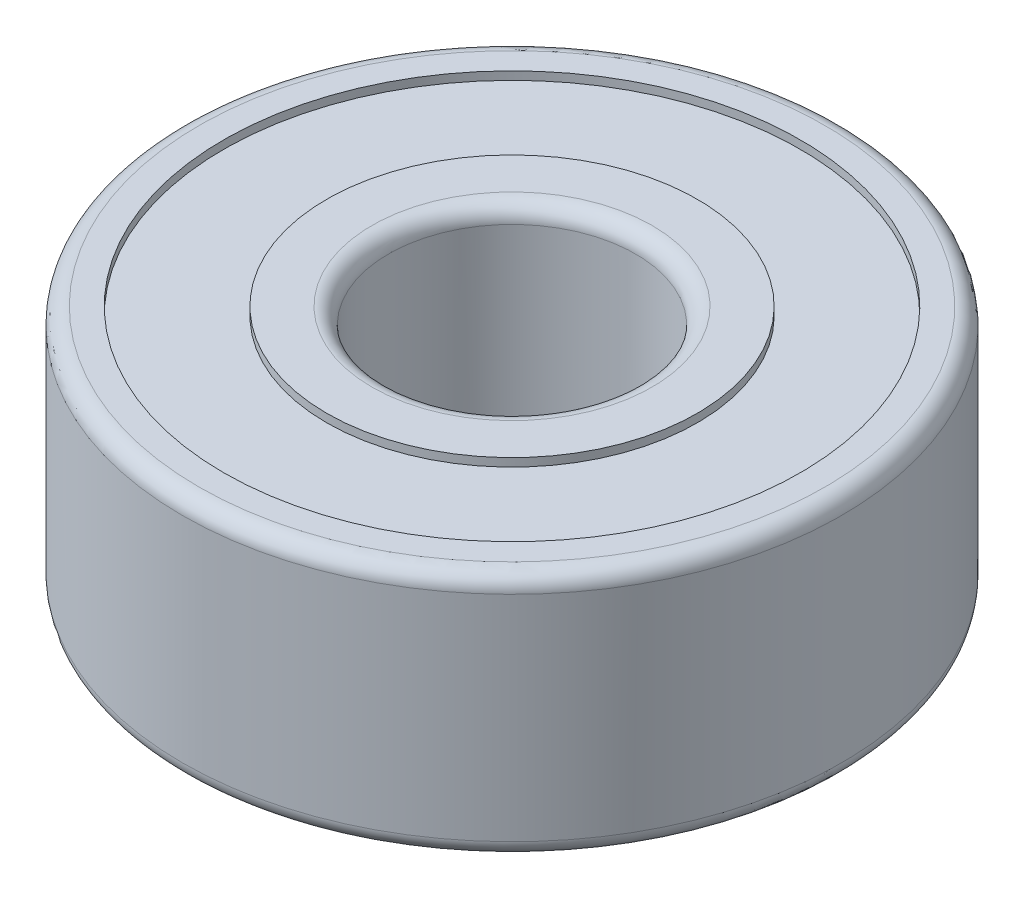
from build123d import *

# Parameters (mm, degrees)
FILLET1_R            = 0.2
FILLET1_OF_MIRROR1_R = 0.2


with BuildPart() as part:
    # Sketch1 → Revolve1 (revolve)
    with BuildSketch(Plane(origin=(0, 0, 0), x_dir=(0, 0, -1), z_dir=(1, 0, 0))):
        Polygon((-4, 1.5), (-3.5, 1.5), (-3.5, 1.4), (-2.25, 1.4), (-2.25, 1.5), (-1.5, 1.5), (-1.5, 0), (-4, 0), align=None)
    revolve1 = revolve(axis=Axis((0, 17.307692308, 0), (0, -1, 0)))

    # Fillet1
    fillet1_edges = [part.edges().sort_by_distance(p)[0] for p in [
        (0, 1.5, -1.5),
        (0, 1.5, -4),
    ]]
    fillet(fillet1_edges, radius=FILLET1_R)

    # Mirror1: Revolve1 across plane
    add(revolve1.mirror(Plane.ZX))

    # Fillet1 of Mirror1
    fillet1_of_mirror1_edges = [part.edges().sort_by_distance(p)[0] for p in [
        (0, -1.5, -1.5),
        (0, -1.5, -4),
    ]]
    fillet(fillet1_of_mirror1_edges, radius=FILLET1_OF_MIRROR1_R)


solid = part.part
